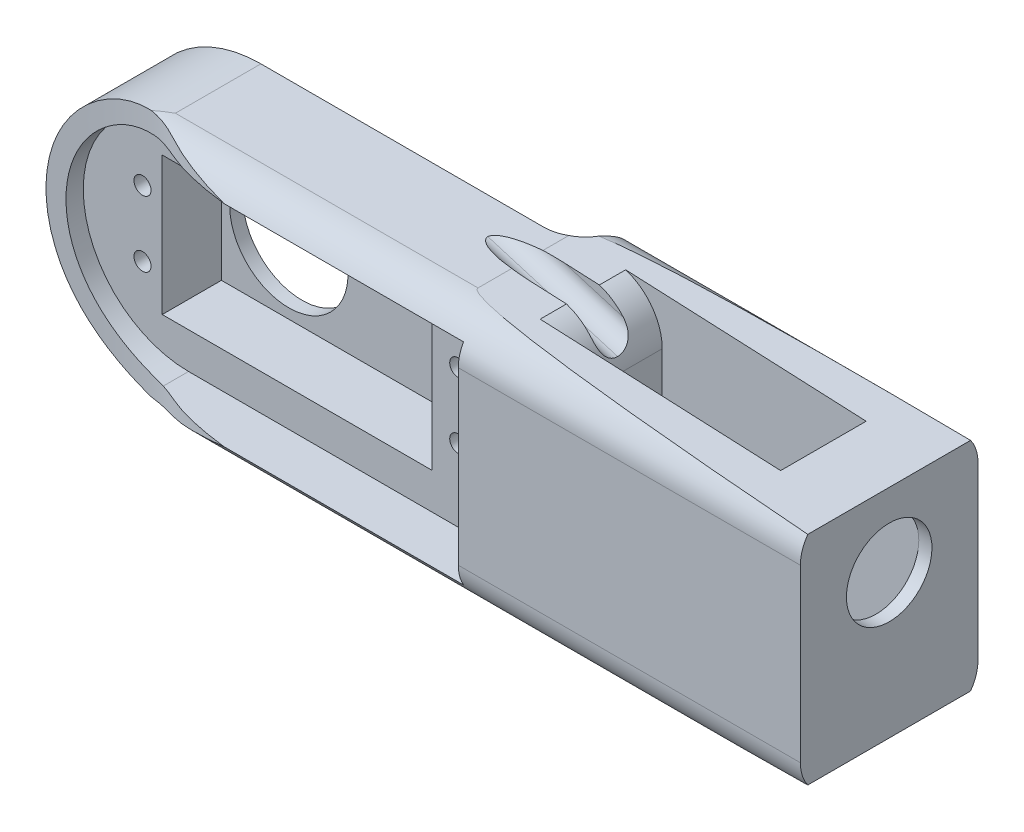
from build123d import *
from OCP.BRepFilletAPI import BRepFilletAPI_MakeChamfer

# Parameters (mm, degrees)
SKETCH1_W               = 120
SKETCH1_H               = 38
SKETCH1_W_2             = 41
SKETCH1_H_2             = 21
BOSS_EXTRUDE1_DEPTH     = 11
SKETCH2_R               = 1.3
CUT_EXTRUDE1_DEPTH      = 8
FILLET1_RADIUS          = 19
FILLET1_LENGTH          = 11
BOSS_EXTRUDE2_START     = 8
BOSS_EXTRUDE2_DEPTH     = 8
FILLET2_R               = 16
CUT_EXTRUDE2_DEPTH      = 66.741919656
CUT_EXTRUDE2_DEPTH_BACK = 66.741919656
BOSS_EXTRUDE3_START     = 8
BOSS_EXTRUDE3_OUTLINE_W = 32
BOSS_EXTRUDE3_OUTLINE_H = 8
BOSS_EXTRUDE3_DEPTH     = 49
SKETCH6_W               = 52
SKETCH6_H               = 38
BOSS_EXTRUDE4_DEPTH     = 8
CUT_EXTRUDE3_DEPTH      = 74.518705262
CUT_EXTRUDE3_DEPTH_BACK = 74.518705262
SKETCH7_W               = 31
SKETCH7_H               = 13
SKETCH8_W               = 13
SKETCH8_H               = 23
CUT_EXTRUDE4_DEPTH      = 8
BOSS_EXTRUDE5_START     = -2
SKETCH9_R               = 9
BOSS_EXTRUDE5_DEPTH     = 2
SKETCH10_R              = 6.5
CUT_EXTRUDE5_DEPTH      = 8
SKETCH12_W              = 5
SKETCH12_H              = 6
CUT_EXTRUDE6_DEPTH      = 20
CHAMFER1_SIZE           = 6
CHAMFER1_SIZE_2         = 20
FILLET3_R               = 8
FILLET4_R               = 6
FILLET5_R               = 6
FILLET6_R               = 2.5
SKETCH13_R              = 1.1
CUT_EXTRUDE7_DEPTH      = 8
CUT_EXTRUDE8_DEPTH      = 69.483574828
CUT_EXTRUDE8_DEPTH_BACK = 69.483574828
CUT_EXTRUDE9_DEPTH      = 66.741919805
CUT_EXTRUDE9_DEPTH_BACK = 66.741919805
SKETCH15_R              = 1.3
SKETCH16_R              = 1.1
BOSS_EXTRUDE6_DEPTH     = 8
SKETCH17_R              = 1
CUT_EXTRUDE10_DEPTH     = 7


# Read off the part's stored shape, not the designer's step: Boss-Extrude3
# Some blends are built 0.0001 mm under size
with BuildPart() as part:
    # Sketch1 → Boss-Extrude1 (new body)
    with BuildSketch(Plane.XY):
        Rectangle(SKETCH1_W, SKETCH1_H)
        with Locations((-24.5, 0)):
            Rectangle(SKETCH1_W_2, SKETCH1_H_2, mode=Mode.SUBTRACT)
    extrude(amount=BOSS_EXTRUDE1_DEPTH)

    # Sketch2 → Cut-Extrude1 (cut)
    with BuildSketch(Plane.XY.offset(1)):
        with Locations((0, 5)):
            Circle(SKETCH2_R)
        with Locations((-48, 5)):
            Circle(SKETCH2_R)
        with Locations((-48, -5)):
            Circle(SKETCH2_R)
        with Locations((0, -5)):
            Circle(SKETCH2_R)
    extrude(amount=CUT_EXTRUDE1_DEPTH, mode=Mode.SUBTRACT)

    # Fillet1: full round fillet: the end face becomes a half cylinder, R = half its width
    fillet1_face = Plane((-60, 0, 5.5), x_dir=(0, 0, 1), z_dir=(-1, 0, 0))  # on the end face: x along it, z out of the body
    fillet1_slab = fillet1_face.offset(-FILLET1_RADIUS / 2) * Box(FILLET1_LENGTH, 2 * FILLET1_RADIUS, FILLET1_RADIUS, mode=Mode.PRIVATE)  # the body's end, R deep
    fillet1_round = Plane((-41, 0, 5.5), x_dir=(-1, 0, 0), z_dir=(0, 0, 1)) * Cylinder(FILLET1_RADIUS, FILLET1_LENGTH, mode=Mode.PRIVATE)  # its axis R under the face
    add(fillet1_slab - fillet1_round, mode=Mode.SUBTRACT)

    # Sketch3 → Boss-Extrude2 (add)
    with BuildSketch(Plane.XY.offset(11).offset(BOSS_EXTRUDE2_START)):
        with BuildLine():
            Line((60, 19), (-41, 19))
            ThreePointArc((-41, 19), (-60, 0), (-41, -19))
            Line((-41, -19), (60, -19))
            Line((60, -19), (60, 19))
        make_face()
        with BuildLine():
            Line((57, 16), (-41, 16))
            ThreePointArc((-41, 16), (-57, 0), (-41, -16))
            Line((-41, -16), (57, -16))
            Line((57, -16), (57, 16))
        make_face(mode=Mode.SUBTRACT)
    extrude(amount=-BOSS_EXTRUDE2_DEPTH)

    # Fillet2
    fillet2_edges = [part.edges().sort_by_distance(p)[0] for p in [
        (57, 16, 15),
        (57, -16, 15),
    ]]
    fillet(fillet2_edges, radius=FILLET2_R - 0.0001)  # a hair under: the kernel refuses the full size

    # Sketch4 → Cut-Extrude2 (cut, two sides: drawn at the far end of the back side and taken through both)
    with BuildSketch(Plane(origin=(0, 0, 0), x_dir=(1, 0, 0), z_dir=(0, 1, 0)).offset(-CUT_EXTRUDE2_DEPTH_BACK)):
        with BuildLine():
            Line((-60, -13.67), (-60, -19))
            Line((-60, -19), (-20, -19))
            add(Edge.make_bspline(
                [(-60, -13.67), (-53.560147586, -13.588290525), (-48.332037755, -13.416667168), (-40.159488654, -14.861068215), (-37.804599967, -16.297682364), (-29.745918458, -18.344163696), (-24.82962643, -18.478671578), (-20, -19)],
                knots=[0, 0, 0, 0, 0.436512255, 0.505229669, 0.666958087, 0.718456725, 1, 1, 1, 1], degree=3))
        make_face()
    extrude(amount=CUT_EXTRUDE2_DEPTH + CUT_EXTRUDE2_DEPTH_BACK, mode=Mode.SUBTRACT)

    # Boss-Extrude3 outline → Boss-Extrude3 (add)
    with BuildSketch(Plane.YZ.offset(BOSS_EXTRUDE3_START)):
        with Locations((0, 15)):
            Rectangle(BOSS_EXTRUDE3_OUTLINE_W, BOSS_EXTRUDE3_OUTLINE_H)
    extrude(amount=BOSS_EXTRUDE3_DEPTH)

    # Sketch6 → Boss-Extrude4 (add)
    with BuildSketch(Plane(origin=(0, 0, 0), x_dir=(-1, 0, 0), z_dir=(0, 0, -1))):
        with Locations((-34, 0)):
            Rectangle(SKETCH6_W, SKETCH6_H)
    extrude(amount=BOSS_EXTRUDE4_DEPTH)

    # Sketch7 → Cut-Extrude3 (cut, two sides: drawn at the far end of the back side and taken through both)
    with BuildSketch(Plane(origin=(0, 19, 0), x_dir=(1, 0, 0), z_dir=(0, 1, 0)).offset(-CUT_EXTRUDE3_DEPTH_BACK)):
        with Locations((34.5, -5.5)):
            Rectangle(SKETCH7_W, SKETCH7_H)
    extrude(amount=CUT_EXTRUDE3_DEPTH + CUT_EXTRUDE3_DEPTH_BACK, mode=Mode.SUBTRACT)

    # Sketch8 → Cut-Extrude4 (cut)
    with BuildSketch(Plane.ZY.offset(-50)):
        with Locations((5.5, 0)):
            Rectangle(SKETCH8_W, SKETCH8_H)
    extrude(amount=-CUT_EXTRUDE4_DEPTH, mode=Mode.SUBTRACT)

    # Sketch9 → Boss-Extrude5 (add)
    with BuildSketch(Plane(origin=(0, 0, 0), x_dir=(-1, 0, 0), z_dir=(0, 0, -1)).offset(BOSS_EXTRUDE5_START)):
        with BuildLine():
            Line((-8, 19), (-8, -19))
            Line((-8, -19), (41, -19))
            ThreePointArc((41, -19), (60, 0), (41, 19))
            Line((41, 19), (-8, 19))
        make_face()
        with Locations((34.75, 0)):
            Circle(SKETCH9_R, mode=Mode.SUBTRACT)
    extrude(amount=BOSS_EXTRUDE5_DEPTH)

    # Sketch10 → Cut-Extrude5 (cut)
    with BuildSketch(Plane(origin=(60, 0, 0), x_dir=(0, 0, -1), z_dir=(1, 0, 0))):
        with Locations(Location((-5.5, 5.3, 0), (0, 0, 90))):
            Circle(SKETCH10_R)
    extrude(amount=-CUT_EXTRUDE5_DEPTH, mode=Mode.SUBTRACT)

    # Sketch12 → Cut-Extrude6 (cut)
    with BuildSketch(Plane(origin=(19, 0, 0), x_dir=(0, 0, -1), z_dir=(1, 0, 0))):
        with Locations((-5.5, 16)):
            Rectangle(SKETCH12_W, SKETCH12_H)
        with Locations((-5.5, -16)):
            Rectangle(SKETCH12_W, SKETCH12_H)
    extrude(amount=-CUT_EXTRUDE6_DEPTH, mode=Mode.SUBTRACT)

    # Chamfer1
    chamfer1_edges_1 = [part.edges().sort_by_distance(p)[0] for p in [
        (-1, -13, 5.5),
    ]]
    chamfer1_side_1 = [part.faces().sort_by_distance(p)[0] for p in [
        (-1, -13.12, 5.5),
    ]]
    chamfer1_edges_2 = [part.edges().sort_by_distance(p)[0] for p in [
        (-1, 13, 5.5),
    ]]
    chamfer1_side_2 = [part.faces().sort_by_distance(p)[0] for p in [
        (-1, 13.12, 5.5),
    ]]
    chamfer1 = BRepFilletAPI_MakeChamfer(part.part.solid().wrapped)
    for e in chamfer1_edges_1:
        chamfer1.Add(CHAMFER1_SIZE - 0.0001, CHAMFER1_SIZE_2 - 0.0001, e.wrapped, chamfer1_side_1[0].wrapped)
    for e in chamfer1_edges_2:
        chamfer1.Add(CHAMFER1_SIZE - 0.0001, CHAMFER1_SIZE_2 - 0.0001, e.wrapped, chamfer1_side_2[0].wrapped)
    add(Compound.cast(chamfer1.Shape()), mode=Mode.REPLACE)  # a hair under: the kernel refuses the full size

    # Fillet3
    # the kernel refuses this fillet: 8 mm, written as the material it takes off along each edge
    with BuildSketch(Plane(origin=(19, 19, -1), x_dir=(0, -1, 0), z_dir=(0, 0, 1))) as fillet3_piece_1_section:
        with BuildLine():
            CenterArc((FILLET3_R, -FILLET3_R), FILLET3_R, 90, 90)
            Line((0, -FILLET3_R), (0, 0))
            Line((0, 0), (FILLET3_R, 0))
        make_face()
    fillet3_piece_1 = extrude(amount=24, mode=Mode.PRIVATE)
    fillet3_piece_1 = split(fillet3_piece_1, bisect_by=Plane(origin=(18.924002019, 12.501601439, 12), z_dir=(0, 0, -1)), keep=Keep.TOP, mode=Mode.PRIVATE)
    add(fillet3_piece_1, mode=Mode.SUBTRACT)
    with BuildSketch(Plane(origin=(19, -19, 23), x_dir=(0, 1, 0), z_dir=(0, 0, -1))) as fillet3_piece_2_section:
        with BuildLine():
            CenterArc((FILLET3_R, -FILLET3_R), FILLET3_R, 90, 90)
            Line((0, -FILLET3_R), (0, 0))
            Line((0, 0), (FILLET3_R, 0))
        make_face()
    fillet3_piece_2 = extrude(amount=24, mode=Mode.PRIVATE)
    fillet3_piece_2 = split(fillet3_piece_2, bisect_by=Plane(origin=(18.924002019, -12.501601439, 12), z_dir=(0, 0, -1)), keep=Keep.TOP, mode=Mode.PRIVATE)
    add(fillet3_piece_2, mode=Mode.SUBTRACT)

    # Fillet4
    # the kernel refuses this fillet: 6 mm, written as the material it takes off along each edge
    with BuildSketch(Plane(origin=(-28, -19, -8), x_dir=(0, 0, 1), z_dir=(1, 0, 0)), Plane(origin=(96, 19, -8), x_dir=(0, 0, 1), z_dir=(-1, 0, 0))) as fillet4_piece_1:
        with BuildLine():
            CenterArc((FILLET4_R, -FILLET4_R), FILLET4_R, 90, 90)
            Line((0, -FILLET4_R), (-FILLET4_R * 0.02, -FILLET4_R))
            Line((-FILLET4_R * 0.02, -FILLET4_R), (-FILLET4_R * 0.02, FILLET4_R * 0.02))
            Line((-FILLET4_R * 0.02, FILLET4_R * 0.02), (FILLET4_R, FILLET4_R * 0.02))
            Line((FILLET4_R, FILLET4_R * 0.02), (FILLET4_R, 0))
        make_face()
    extrude(amount=124, mode=Mode.SUBTRACT)
    with BuildSketch(Plane(origin=(96, 19, 19), x_dir=(0, 0, -1), z_dir=(-1, 0, 0)), Plane(origin=(-56, -19, 19), x_dir=(0, 0, -1), z_dir=(1, 0, 0))) as fillet4_piece_2:
        with BuildLine():
            CenterArc((FILLET4_R, FILLET4_R), FILLET4_R, 180, 90)
            Line((0, FILLET4_R), (-FILLET4_R * 0.02, FILLET4_R))
            Line((-FILLET4_R * 0.02, FILLET4_R), (-FILLET4_R * 0.02, -FILLET4_R * 0.02))
            Line((-FILLET4_R * 0.02, -FILLET4_R * 0.02), (FILLET4_R, -FILLET4_R * 0.02))
            Line((FILLET4_R, -FILLET4_R * 0.02), (FILLET4_R, 0))
        make_face()
    extrude(amount=152, mode=Mode.SUBTRACT)

    # Fillet5
    fillet5_edges = [part.edges().sort_by_distance(p)[0] for p in [
        (8, 0, 0),
    ]]
    fillet(fillet5_edges, radius=FILLET5_R)

    # Fillet6
    fillet6_edges = [part.edges().sort_by_distance(p)[0] for p in [
        (8.862066808, 16.041314475, 3),
        (8.862066808, 16.041314475, 8),
        (8.862066808, -16.041314475, 8),
        (8.862066808, -16.041314475, 3),
    ]]
    fillet(fillet6_edges, radius=FILLET6_R - 0.0001)  # a hair under: the kernel refuses the full size

    # Sketch13 → Cut-Extrude7 (cut)
    with BuildSketch(Plane.ZY.offset(-50)):
        with Locations((6.5, 13.8)):
            Circle(SKETCH13_R)
        with Locations((6.5, -13.8)):
            Circle(SKETCH13_R)
    extrude(amount=-CUT_EXTRUDE7_DEPTH, mode=Mode.SUBTRACT)

    # Sketch14 → Cut-Extrude8 (cut, two sides: drawn at the far end of the back side and taken through both)
    with BuildSketch(Plane.XY.offset(19).offset(-CUT_EXTRUDE8_DEPTH_BACK)):
        Polygon((5, 19), (60, 16.5), (60, 19), align=None)
        Polygon((60, -19), (60, -16.5), (5, -19), align=None)
    extrude(amount=CUT_EXTRUDE8_DEPTH + CUT_EXTRUDE8_DEPTH_BACK, mode=Mode.SUBTRACT)

    # Sketch15 → Cut-Extrude9 (cut, two sides: drawn at the far end of the back side and taken through both)
    with BuildSketch(Plane.XY.offset(11).offset(-CUT_EXTRUDE9_DEPTH_BACK)):
        with Locations((0, -5)):
            Circle(SKETCH15_R)
        with Locations((-48, -5)):
            Circle(SKETCH15_R)
        with Locations((-48, 5)):
            Circle(SKETCH15_R)
        with Locations((0, 5)):
            Circle(SKETCH15_R)
    extrude(amount=CUT_EXTRUDE9_DEPTH + CUT_EXTRUDE9_DEPTH_BACK, mode=Mode.SUBTRACT)

    # Sketch16 → Boss-Extrude6 (add)
    with BuildSketch(Plane.ZY.offset(-50)):
        with Locations((6.5, -13.8)):
            Circle(SKETCH16_R)
        with Locations((6.5, 13.8)):
            Circle(SKETCH16_R)
    extrude(amount=-BOSS_EXTRUDE6_DEPTH)

    # Sketch17 → Cut-Extrude10 (cut)
    with BuildSketch(Plane.ZY.offset(-50)):
        with Locations((5.5, -13.6)):
            Circle(SKETCH17_R)
        with Locations((5.5, 14)):
            Circle(SKETCH17_R)
    extrude(amount=-CUT_EXTRUDE10_DEPTH, mode=Mode.SUBTRACT)


solid = part.part
